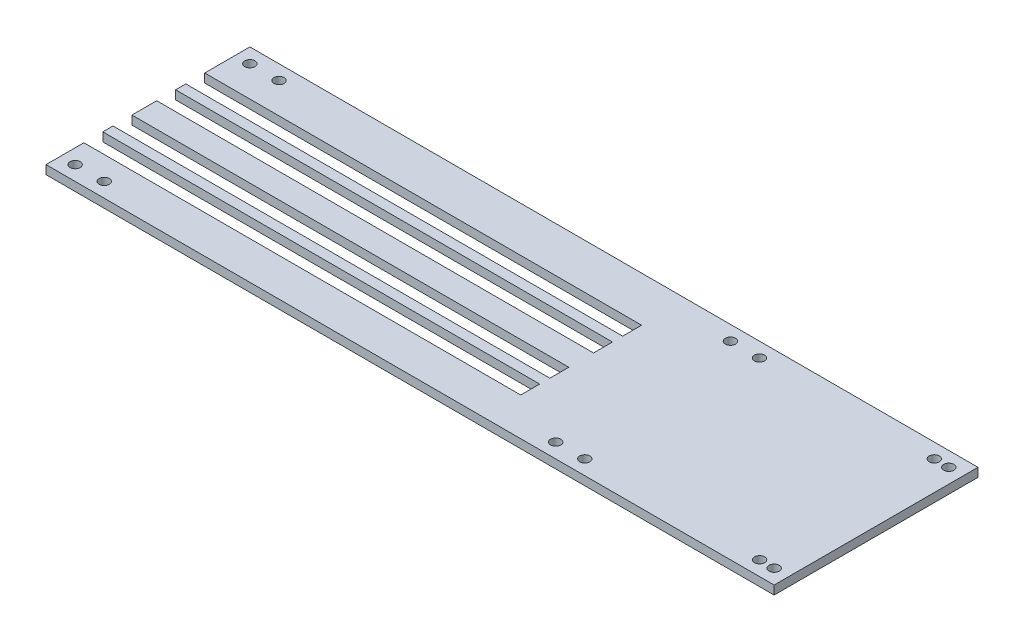
from build123d import *

# Parameters (mm, degrees)
BOSS_EXTRUDE1_DEPTH = 3
SKETCH2_R           = 1.75
CUT_EXTRUDE1_DEPTH  = 10
SKETCH3_R           = 1.75
CUT_EXTRUDE2_DEPTH  = 10


with BuildPart() as part:
    # Sketch1 → Boss-Extrude1 (new body)
    with BuildSketch(Plane(origin=(0, 0, 0), x_dir=(1, 0, 0), z_dir=(0, 1, 0))):
        Polygon((-150, 29.5), (0, 29.5), (0, 23), (-150, 23), (-150, 19.5), (0, 19.5), (0, 13), (-150, 13), (-150, 0), (0, 0), (100, 0), (100, 70), (-50, 70), (-150, 70), (-150, 54.5), (0, 54.5), (0, 48), (-150, 48), (-150, 44.5), (0, 44.5), (0, 38), (-150, 38), align=None)
    extrude(amount=BOSS_EXTRUDE1_DEPTH)

    # Sketch2 → Cut-Extrude1 (cut)
    with BuildSketch(Plane(origin=(0, 3, 0), x_dir=(1, 0, 0), z_dir=(0, 1, 0))):
        with Locations((-145, 65)):
            Circle(SKETCH2_R)
        with Locations((-135, 65)):
            Circle(SKETCH2_R)
        with Locations((20, 65)):
            Circle(SKETCH2_R)
        with Locations((30, 65)):
            Circle(SKETCH2_R)
    cut_extrude1 = extrude(amount=-CUT_EXTRUDE1_DEPTH, mode=Mode.SUBTRACT)

    # Sketch3 → Cut-Extrude2 (cut)
    with BuildSketch(Plane(origin=(0, 3, 0), x_dir=(1, 0, 0), z_dir=(0, 1, 0))):
        with Locations((95, 65)):
            Circle(SKETCH3_R)
        with Locations((90, 65)):
            Circle(SKETCH3_R)
    cut_extrude2 = extrude(amount=-CUT_EXTRUDE2_DEPTH, mode=Mode.SUBTRACT)

    # Mirror1: Cut-Extrude1, Cut-Extrude2 across plane
    add(cut_extrude1.mirror(Plane(origin=(0, 0, -35), x_dir=(1, 0, 0), z_dir=(0, 0, -1))), mode=Mode.SUBTRACT)
    add(cut_extrude2.mirror(Plane(origin=(0, 0, -35), x_dir=(1, 0, 0), z_dir=(0, 0, -1))), mode=Mode.SUBTRACT)


solid = part.part
